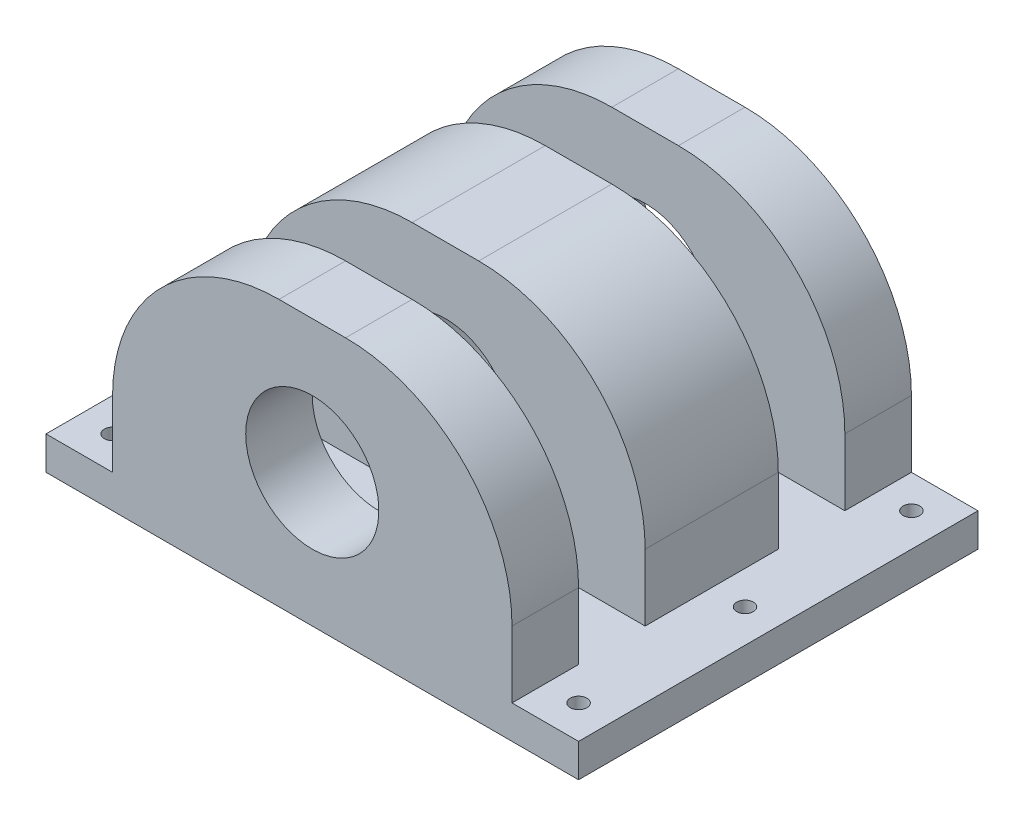
from build123d import *

# Parameters (mm, degrees)
SKETCH1_R                   = 25.4
BOSS_EXTRUDE1_DEPTH         = 152.4
CUT_EXTRUDE1_DEPTH          = 191.076195248
CUT_EXTRUDE1_DEPTH_BACK     = 191.076195248
SKETCH3_W                   = 25.4
SKETCH3_H                   = 88.9
F_1_4_0_25_DIAMETER_HOLE1_D = 6.35


with BuildPart() as part:
    # Sketch1 → Boss-Extrude1 (new body)
    with BuildSketch(Plane.XY):
        with BuildLine():
            Line((-76.2, -50.8), (76.2, -50.8))
            Line((76.2, -50.8), (101.6, -50.8))
            Line((101.6, -50.8), (101.6, -38.1))
            Line((101.6, -38.1), (76.2, -38.1))
            Line((76.2, -38.1), (76.2, -12.7))
            ThreePointArc((76.2, -12.7), (57.601280605, 32.201280605), (12.7, 50.8))
            Line((12.7, 50.8), (-12.7, 50.8))
            ThreePointArc((-12.7, 50.8), (-57.601280605, 32.201280605), (-76.2, -12.7))
            Line((-76.2, -12.7), (-76.2, -38.1))
            Line((-76.2, -38.1), (-101.6, -38.1))
            Line((-101.6, -38.1), (-101.6, -50.8))
            Line((-101.6, -50.8), (-76.2, -50.8))
        make_face()
        Circle(SKETCH1_R, mode=Mode.SUBTRACT)
    extrude(amount=BOSS_EXTRUDE1_DEPTH)

    # Sketch3 → Cut-Extrude1 (cut, two sides: drawn at the far end of the back side and taken through both)
    with BuildSketch(Plane(origin=(0, 0, 0), x_dir=(0, 0, -1), z_dir=(1, 0, 0)).offset(-CUT_EXTRUDE1_DEPTH_BACK)):
        with Locations((-114.3, 6.35)):
            Rectangle(SKETCH3_W, SKETCH3_H)
        with Locations((-38.1, 6.35)):
            Rectangle(SKETCH3_W, SKETCH3_H)
    extrude(amount=CUT_EXTRUDE1_DEPTH + CUT_EXTRUDE1_DEPTH_BACK, mode=Mode.SUBTRACT)

    # 1/4 (0.25) Diameter Hole1 (through all)
    with Locations(Plane(origin=(0, -38.1, 0), x_dir=(1, 0, 0), z_dir=(0, 1, 0))):
        with Locations((-88.9, -76.2), (-88.9, -12.7), (-88.9, -139.7), (88.9, -12.7), (88.9, -76.2), (88.9, -139.7)):
            Hole(F_1_4_0_25_DIAMETER_HOLE1_D / 2)


solid = part.part
